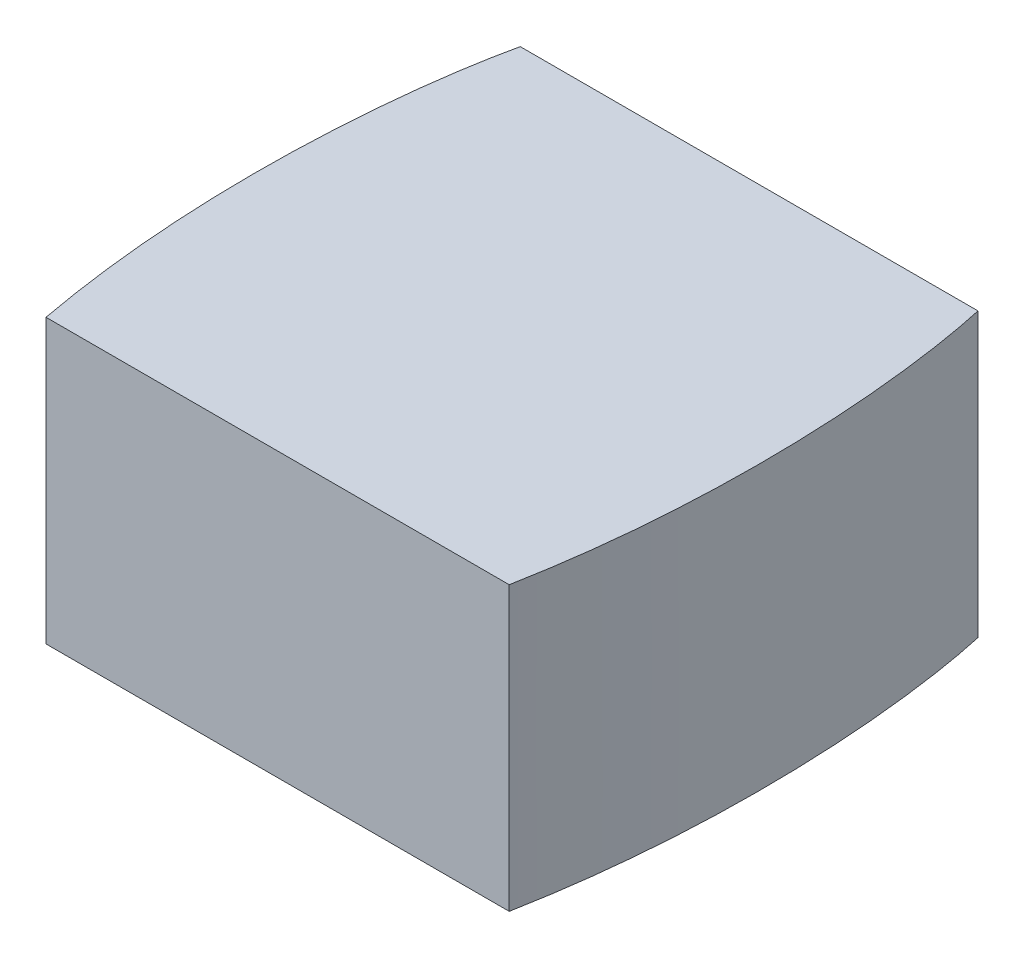
from build123d import *

# Parameters (mm, degrees)
SKETCH4_W               = 60
SKETCH4_H               = 30
BOSS_EXTRUDE3_DEPTH     = 50
CUT_EXTRUDE1_DEPTH      = 84.666002653
CUT_EXTRUDE1_DEPTH_BACK = 50


with BuildPart() as part:
    # Sketch4 → Boss-Extrude3 (new body)
    with BuildSketch(Plane.XY):
        with Locations((30, -15)):
            Rectangle(SKETCH4_W, SKETCH4_H)
    extrude(amount=BOSS_EXTRUDE3_DEPTH)

    # Sketch5 → Cut-Extrude1 (cut, two sides: drawn at the far end of the back side and taken through both)
    with BuildSketch(Plane.XZ.offset(30).offset(-CUT_EXTRUDE1_DEPTH_BACK)):
        with BuildLine():
            Line((60, 50), (54.560527712, 50))
            add(Edge.make_bspline(
                [(54.560527712, 50), (58.282049008, 30.169714467), (56.584137074, 10.400719242), (54.270039606, 0)],
                knots=[0, 0, 0, 0, 0.76812731, 0.76812731, 0.76812731, 0.76812731], degree=3))
            Line((54.270039606, 0), (60, 0))
            Line((60, 0), (60, 50))
        make_face()
        with BuildLine():
            add(Edge.make_bspline(
                [(5.439472288, 50), (1.717950992, 30.169714467), (3.415862926, 10.400719242), (5.729960394, 0)],
                knots=[0, 0, 0, 0, 0.76812731, 0.76812731, 0.76812731, 0.76812731], degree=3))
            Line((5.439472288, 50), (0, 50))
            Line((0, 50), (0, 0))
            Line((0, 0), (5.729960394, 0))
        make_face()
    extrude(amount=CUT_EXTRUDE1_DEPTH + CUT_EXTRUDE1_DEPTH_BACK, mode=Mode.SUBTRACT)


solid = part.part
